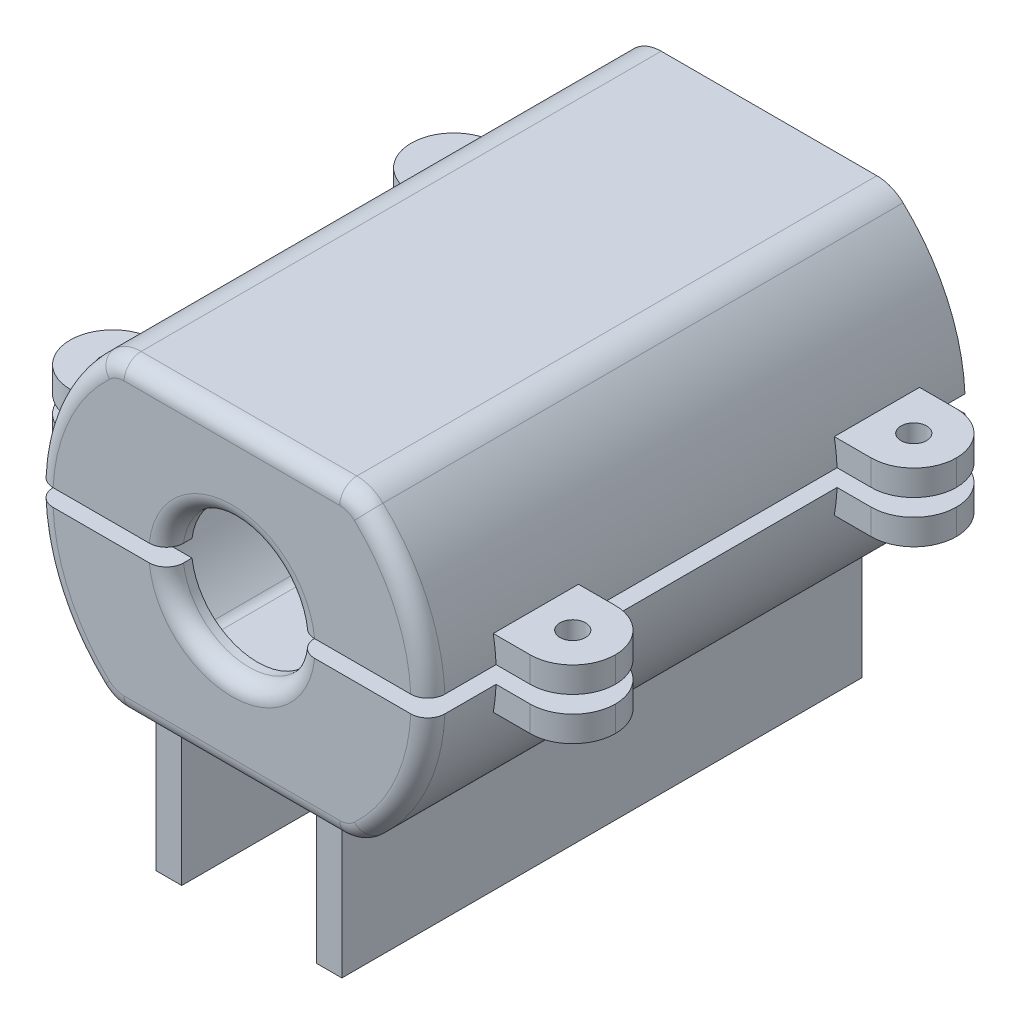
from build123d import *

# Parameters (mm, degrees)
BOSS_EXTRUDE1_DEPTH     = 60
BOSS_EXTRUDE2_START     = 3
SKETCH2_R               = 7.75
BOSS_EXTRUDE2_DEPTH     = 3
FILLET1_R               = 2
CUT_EXTRUDE1_DEPTH      = 70.440622117
CUT_EXTRUDE1_DEPTH_BACK = 70.440622117
SKETCH5_W               = 55
SKETCH5_H               = 2
SKETCH6_W               = 3
SKETCH6_H               = 61
BOSS_EXTRUDE5_DEPTH     = 15.875
BOSS_EXTRUDE6_START     = 1
SKETCH7_W               = 12
SKETCH7_H               = 10
BOSS_EXTRUDE6_DEPTH     = 3
BOSS_EXTRUDE7_START     = -1
SKETCH7_2_W             = 12
SKETCH7_2_H             = 10
BOSS_EXTRUDE7_DEPTH     = 3
FILLET2_R               = 5
FILLET3_R               = 5
SKETCH8_R               = 1.5
CUT_EXTRUDE2_DEPTH      = 13


with BuildPart() as part:
    # Sketch1 → Boss-Extrude1 (new body)
    with BuildSketch(Plane.XY):
        with BuildLine():
            Line((12.649110641, 18), (-12.649110641, 18))
            ThreePointArc((-12.649110641, 18), (-14.30334354, 17.684914995), (-15.725921337, 16.783783784))
            ThreePointArc((-15.725921337, 16.783783784), (-23, 0), (-15.725921337, -16.783783784))
            ThreePointArc((-15.725921337, -16.783783784), (-14.30334354, -17.684914995), (-12.649110641, -18))
            Line((-12.649110641, -18), (12.649110641, -18))
            ThreePointArc((12.649110641, -18), (14.30334354, -17.684914995), (15.725921337, -16.783783784))
            ThreePointArc((15.725921337, -16.783783784), (23, 0), (15.725921337, 16.783783784))
            ThreePointArc((15.725921337, 16.783783784), (14.30334354, 17.684914995), (12.649110641, 18))
        make_face()
        with BuildLine():
            ThreePointArc((12.649110641, -15), (13.200521607, -14.894971665), (13.674714206, -14.594594595))
            ThreePointArc((13.674714206, -14.594594595), (20, 0), (13.674714206, 14.594594595))
            ThreePointArc((13.674714206, 14.594594595), (13.200521607, 14.894971665), (12.649110641, 15))
            Line((12.649110641, 15), (-12.649110641, 15))
            ThreePointArc((-12.649110641, 15), (-13.200521607, 14.894971665), (-13.674714206, 14.594594595))
            ThreePointArc((-13.674714206, 14.594594595), (-20, 0), (-13.674714206, -14.594594595))
            ThreePointArc((-13.674714206, -14.594594595), (-13.200521607, -14.894971665), (-12.649110641, -15))
            Line((-12.649110641, -15), (12.649110641, -15))
        make_face(mode=Mode.SUBTRACT)
    extrude(amount=-BOSS_EXTRUDE1_DEPTH)

    # Sketch2 → Boss-Extrude2 (add)
    # profile 1 of 2: a face of its own
    with BuildSketch(Plane.XY.offset(BOSS_EXTRUDE2_START)):
        with BuildLine():
            ThreePointArc((15.725921337, 16.783783784), (14.30334354, 17.684914995), (12.649110641, 18))
            Line((12.649110641, 18), (-12.649110641, 18))
            ThreePointArc((-12.649110641, 18), (-14.30334354, 17.684914995), (-15.725921337, 16.783783784))
            ThreePointArc((-15.725921337, 16.783783784), (-23, 0), (-15.725921337, -16.783783784))
            ThreePointArc((-15.725921337, -16.783783784), (-14.30334354, -17.684914995), (-12.649110641, -18))
            Line((-12.649110641, -18), (12.649110641, -18))
            ThreePointArc((12.649110641, -18), (14.30334354, -17.684914995), (15.725921337, -16.783783784))
            ThreePointArc((15.725921337, -16.783783784), (23, 0), (15.725921337, 16.783783784))
        make_face()
        with BuildLine():
            ThreePointArc((13.674714206, 14.594594595), (20, 0), (13.674714206, -14.594594595))
            ThreePointArc((13.674714206, -14.594594595), (13.200521607, -14.894971665), (12.649110641, -15))
            Line((12.649110641, -15), (-12.649110641, -15))
            ThreePointArc((-12.649110641, -15), (-13.200521607, -14.894971665), (-13.674714206, -14.594594595))
            ThreePointArc((-13.674714206, -14.594594595), (-20, 0), (-13.674714206, 14.594594595))
            ThreePointArc((-13.674714206, 14.594594595), (-13.200521607, 14.894971665), (-12.649110641, 15))
            Line((-12.649110641, 15), (12.649110641, 15))
            ThreePointArc((12.649110641, 15), (13.200521607, 14.894971665), (13.674714206, 14.594594595))
        make_face(mode=Mode.SUBTRACT)
    # profile 2 of 2: a face of its own
    with BuildSketch(Plane.XY.offset(BOSS_EXTRUDE2_START)):
        with BuildLine():
            ThreePointArc((13.674714206, -14.594594595), (13.200521607, -14.894971665), (12.649110641, -15))
            Line((12.649110641, -15), (-12.649110641, -15))
            ThreePointArc((-12.649110641, -15), (-13.200521607, -14.894971665), (-13.674714206, -14.594594595))
            ThreePointArc((-13.674714206, -14.594594595), (-20, 0), (-13.674714206, 14.594594595))
            ThreePointArc((-13.674714206, 14.594594595), (-13.200521607, 14.894971665), (-12.649110641, 15))
            Line((-12.649110641, 15), (12.649110641, 15))
            ThreePointArc((12.649110641, 15), (13.200521607, 14.894971665), (13.674714206, 14.594594595))
            ThreePointArc((13.674714206, 14.594594595), (20, 0), (13.674714206, -14.594594595))
        make_face()
        Circle(SKETCH2_R, mode=Mode.SUBTRACT)
    extrude(amount=-BOSS_EXTRUDE2_DEPTH)

    # Fillet1
    fillet1_edges = [part.edges().sort_by_distance(p)[0] for p in [
        (-7.75, 0, 3),
        (14.30334354, 17.684914995, 3),
        (0, 18, 3),
        (-14.30334354, 17.684914995, 3),
        (-23, 0, 3),
        (-14.30334354, -17.684914995, 3),
        (0, -18, 3),
        (14.30334354, -17.684914995, 3),
        (23, 0, 3),
    ]]
    fillet(fillet1_edges, radius=FILLET1_R)

    # Sketch5 → Cut-Extrude1 (cut, two sides: drawn at the far end of the back side and taken through both)
    with BuildSketch(Plane.XY.offset(3).offset(-CUT_EXTRUDE1_DEPTH_BACK)):
        Rectangle(SKETCH5_W, SKETCH5_H)
    extrude(amount=CUT_EXTRUDE1_DEPTH + CUT_EXTRUDE1_DEPTH_BACK, mode=Mode.SUBTRACT)


with BuildPart() as cut_extrude1_piece_1:
    # of the separate pieces the step leaves, piece 1, a body of its own (cut_extrude1_pieces)
    add(part.part.solids().sort_by_distance((15.725921337, -16.783783784, -60))[0])

    # Sketch6 → Boss-Extrude5 (add)
    with BuildSketch(Plane.XZ.offset(18)):
        with Locations((-9.3925, -29.5)):
            Rectangle(SKETCH6_W, SKETCH6_H)
        with Locations((9.3925, -29.5)):
            Rectangle(SKETCH6_W, SKETCH6_H)
    extrude(amount=BOSS_EXTRUDE5_DEPTH)

    # Sketch7<2> → Boss-Extrude7 (add)
    with BuildSketch(Plane(origin=(0, 0, 0), x_dir=(1, 0, 0), z_dir=(0, 1, 0)).offset(BOSS_EXTRUDE7_START)):
        with Locations((-25.974984355, 50)):
            Rectangle(SKETCH7_2_W, SKETCH7_2_H)
        with Locations((-25.974984355, 10)):
            Rectangle(SKETCH7_2_W, SKETCH7_2_H)
        with Locations((25.974984355, 10)):
            Rectangle(SKETCH7_2_W, SKETCH7_2_H)
        with Locations((25.974984355, 50)):
            Rectangle(SKETCH7_2_W, SKETCH7_2_H)
    extrude(amount=-BOSS_EXTRUDE7_DEPTH)

    # Fillet3
    fillet3_edges = [cut_extrude1_piece_1.edges().sort_by_distance(p)[0] for p in [
        (31.974984355, -2.5, -55),
        (31.974984355, -2.5, -45),
        (31.974984355, -2.5, -15),
        (31.974984355, -2.5, -5),
        (-31.974984355, -2.5, -5),
        (-31.974984355, -2.5, -15),
        (-31.974984355, -2.5, -45),
        (-31.974984355, -2.5, -55),
    ]]
    fillet(fillet3_edges, radius=FILLET3_R - 0.0001)  # a hair under: the kernel refuses the full size


with BuildPart() as cut_extrude1_piece_2:
    # of the separate pieces the step leaves, piece 2, a body of its own (cut_extrude1_pieces)
    add(part.part.solids().sort_by_distance((12.649110641, 18, 1))[0])

    # Sketch7 → Boss-Extrude6 (add)
    with BuildSketch(Plane(origin=(0, 0, 0), x_dir=(1, 0, 0), z_dir=(0, 1, 0)).offset(BOSS_EXTRUDE6_START)):
        with Locations((-25.974984355, 50)):
            Rectangle(SKETCH7_W, SKETCH7_H)
        with Locations((-25.974984355, 10)):
            Rectangle(SKETCH7_W, SKETCH7_H)
        with Locations((25.974984355, 10)):
            Rectangle(SKETCH7_W, SKETCH7_H)
        with Locations((25.974984355, 50)):
            Rectangle(SKETCH7_W, SKETCH7_H)
    extrude(amount=BOSS_EXTRUDE6_DEPTH)

    # Fillet2
    fillet2_edges = [cut_extrude1_piece_2.edges().sort_by_distance(p)[0] for p in [
        (31.974984355, 2.5, -45),
        (31.974984355, 2.5, -55),
        (31.974984355, 2.5, -15),
        (31.974984355, 2.5, -5),
        (-31.974984355, 2.5, -15),
        (-31.974984355, 2.5, -5),
        (-31.974984355, 2.5, -55),
        (-31.974984355, 2.5, -45),
    ]]
    fillet(fillet2_edges, radius=FILLET2_R - 0.0001)  # a hair under: the kernel refuses the full size


with BuildPart() as cut_extrude2_tool:
    # Sketch8 → Cut-Extrude2 (new body)
    with BuildSketch(Plane(origin=(0, 4, 0), x_dir=(1, 0, 0), z_dir=(0, 1, 0))):
        with Locations(Location((-26.974984355, 50, 0), (0, 0, 90))):
            Circle(SKETCH8_R)
        with Locations(Location((-26.974984355, 10, 0), (0, 0, 90))):
            Circle(SKETCH8_R)
        with Locations(Location((26.974984355, 10, 0), (0, 0, 90))):
            Circle(SKETCH8_R)
        with Locations(Location((26.974984355, 50, 0), (0, 0, 90))):
            Circle(SKETCH8_R)
    extrude(amount=-CUT_EXTRUDE2_DEPTH)


with BuildPart() as cut_extrude1_piece_1_1:
    add(cut_extrude1_piece_1.part)

    # Cut-Extrude2: cut by cut_extrude2_tool
    add(cut_extrude2_tool.part, mode=Mode.SUBTRACT)


with BuildPart() as cut_extrude1_piece_2_1:
    add(cut_extrude1_piece_2.part)

    # Cut-Extrude2: cut by cut_extrude2_tool
    add(cut_extrude2_tool.part, mode=Mode.SUBTRACT)


solid = Compound([cut_extrude1_piece_1_1.part, cut_extrude1_piece_2_1.part])
